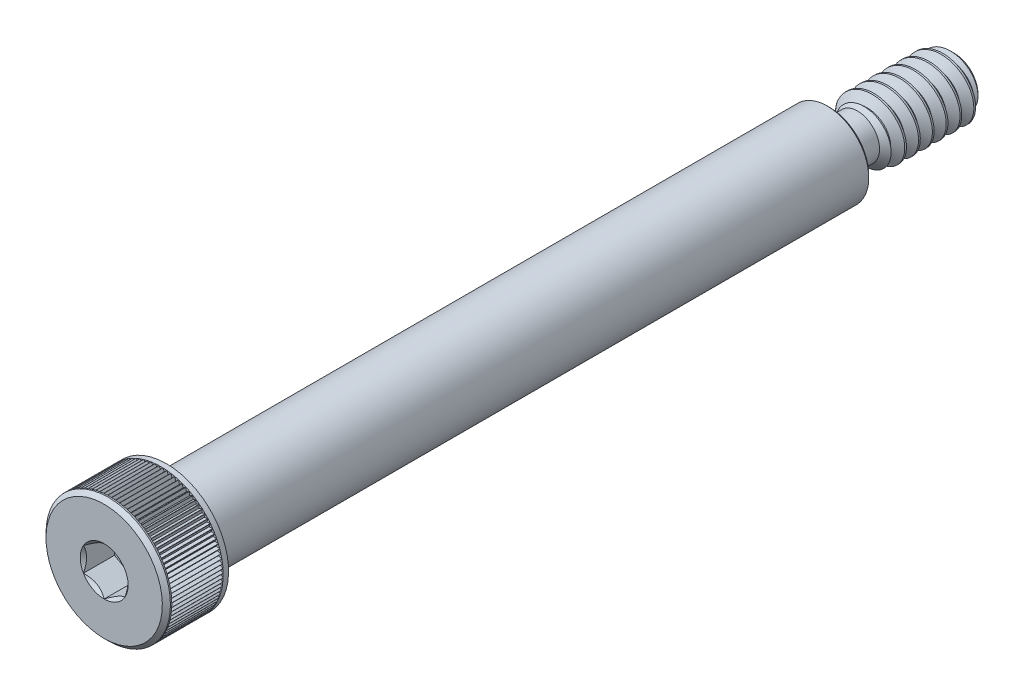
from build123d import *

# Parameters (mm, degrees)
CHAMFER1_SIZE      = 0.60325
CHAMFER2_SIZE      = 0.3095625
CHAMFER3_SIZE      = 0.2032
CUT_EXTRUDE5_DEPTH = 1.968103125
CIRPATTERN1_COUNT  = 99
CUT_EXTRUDE2_DEPTH = 2.38125
CUT_SWEEP1_PITCH   = 1.058333333


with BuildPart() as part:
    # Sketch1 → Revolve1 (revolve)
    with BuildSketch(Plane(origin=(0, 0, 0), x_dir=(0, 0, -1), z_dir=(1, 0, 0))):
        Polygon((0, 4.7625), (4.7625, 4.7625), (4.7625, 3.175), (55.5625, 3.175), (55.5625, 2.413), (65.0875, 2.413), (65.0875, 0), (0, 0), align=None)
    revolve(axis=Axis((0, 0, -65.0875), (0, 0, 1)))

    # Sketch5 → Cut-Revolve1 (revolve, cut)
    with BuildSketch(Plane(origin=(0, 0, 0), x_dir=(0, 0, -1), z_dir=(1, 0, 0))):
        with BuildLine():
            Line((55.5625, 3.175), (59.1566, 3.175))
            Line((59.1566, 3.175), (57.6707, 1.6891))
            Line((57.6707, 1.6891), (56.2864, 1.6891))
            ThreePointArc((56.2864, 1.6891), (55.774525401, 1.901125401), (55.5625, 2.413))
            Line((55.5625, 2.413), (55.5625, 3.175))
        make_face()
    revolve(axis=Axis((0, 0, -65.0875), (0, 0, 1)), mode=Mode.SUBTRACT)

    # Chamfer1
    chamfer1_edges = [part.edges().sort_by_distance(p)[0] for p in [
        (0, -2.413, -65.0875),
    ]]
    chamfer(chamfer1_edges, length=CHAMFER1_SIZE)

    # Chamfer2
    chamfer2_edges = [part.edges().sort_by_distance(p)[0] for p in [
        (0, -4.7625, 0),
    ]]
    chamfer(chamfer2_edges, length=CHAMFER2_SIZE)

    # Chamfer3
    chamfer3_edges = [part.edges().sort_by_distance(p)[0] for p in [
        (0, -3.175, -55.5625),
    ]]
    chamfer(chamfer3_edges, length=CHAMFER3_SIZE)

    # Sketch11 → Cut-Extrude5 (cut, symmetric)
    with BuildSketch(Plane.XY.offset(-2.38125)):
        Polygon((0, 4.51485), (0.142980794, 4.7625), (-0.142980794, 4.7625), align=None)
    cut_extrude5 = extrude(amount=CUT_EXTRUDE5_DEPTH, both=True, mode=Mode.SUBTRACT)

    # CirPattern1: Cut-Extrude5 ×99 about axis
    cirpattern1_axis = Axis((0, 0, 0), (0, 0, 1))
    for i in range(1, CIRPATTERN1_COUNT):
        add(cut_extrude5.rotate(cirpattern1_axis, i * 360 / CIRPATTERN1_COUNT), mode=Mode.SUBTRACT)

    # Sketch8 → Cut-Extrude2 (cut)
    with BuildSketch(Plane.XY):
        Polygon((1.5875, 0.916543552), (0, 1.833087105), (-1.5875, 0.916543552), (-1.5875, -0.916543552), (0, -1.833087105), (1.5875, -0.916543552), align=None)
    extrude(amount=-CUT_EXTRUDE2_DEPTH, mode=Mode.SUBTRACT)

    # Cut-Extrude4 cone 1 section (through the dimple's axis) → Cut-Extrude4 (revolve, cut)
    with BuildSketch(Plane(origin=(0, 0, 0), x_dir=(0, -1, 0), z_dir=(1, 0, 0))):
        Polygon((0, 0), (1.833087105, 0), (0, 1.833087105), align=None)
    revolve(axis=Axis((0, 0, 0), (0, 0, -1)), mode=Mode.SUBTRACT)

    # Cut-Sweep1: the profile of Sketch4 screwed along a right-hand helix of 10 turns, 8 arcs to a turn; built about Z, then put on its axis
    cut_sweep1_z = Axis((0, 0, 0), (0, 0, 1))
    cut_sweep1_corners = [(2.470283972, 0, 0.033072917), (2.470283972, 0, -0.959114583), (1.725592336, 0, -0.529166667), (1.725592336, 0, -0.396875)]
    with BuildLine(mode=Mode.PRIVATE) as cut_sweep1_profile:
        Line(cut_sweep1_corners[0], cut_sweep1_corners[1])
        Line(cut_sweep1_corners[1], cut_sweep1_corners[2])
        Line(cut_sweep1_corners[2], cut_sweep1_corners[3])
        Line(cut_sweep1_corners[3], cut_sweep1_corners[0])
    cut_sweep1_cap = Face(cut_sweep1_profile.wire())
    cut_sweep1_turn_angles = [0, 22.5, 45, 67.5, 90, 112.5, 135, 157.5, 180, 202.5, 225, 247.5, 270, 292.5, 315, 337.5, 360]
    cut_sweep1_turn_weights = [1, 0.9238795325112867, 1, 0.9238795325112867, 1, 0.9238795325112867, 1, 0.9238795325112867, 1, 0.9238795325112867, 1, 0.9238795325112867, 1, 0.9238795325112867, 1, 0.9238795325112867, 1]
    cut_sweep1_turn_rails = [Edge.make_bspline([Vector(p[0], p[1], 0).rotate(cut_sweep1_z, cut_sweep1_turn_angles[k]) / cut_sweep1_turn_weights[k] + Vector(0, 0, p[2] + CUT_SWEEP1_PITCH * cut_sweep1_turn_angles[k] / 360) for k in range(17)], [0, 0, 0, 1, 1, 2, 2, 3, 3, 4, 4, 5, 5, 6, 6, 7, 7, 8, 8, 8], 2, cut_sweep1_turn_weights) for p in cut_sweep1_corners]
    cut_sweep1_turn_sides = [Face.make_surface_from_curves(cut_sweep1_turn_rails[p[0]], cut_sweep1_turn_rails[p[1]]) for p in [(0, 1), (1, 2), (2, 3), (3, 0)]]
    cut_sweep1 = Plane(origin=(0, 0, -65.0875), x_dir=(0, 1, 0), z_dir=(0, 0, 1)) * Solid(Shell([*[p.moved(Location((0, 0, CUT_SWEEP1_PITCH * i))) for i in range(10) for p in cut_sweep1_turn_sides], cut_sweep1_cap, cut_sweep1_cap.rotate(cut_sweep1_z, 3600).moved(Location((0, 0, CUT_SWEEP1_PITCH * 3600 / 360)))]))
    add(cut_sweep1, mode=Mode.SUBTRACT)

    # Sketch12 → Revolve2 (revolve)
    with BuildSketch(Plane(origin=(0, 0, 0), x_dir=(0, 0, -1), z_dir=(1, 0, 0))):
        with BuildLine():
            Line((55.5625, 2.9718), (55.3593, 3.175))
            Line((55.3593, 3.175), (4.7625, 3.175))
            Line((4.7625, 3.175), (4.7625, 0))
            Line((4.7625, 0), (55.5625, 0))
            Line((55.5625, 0), (57.6707, 0))
            Line((57.6707, 0), (57.6707, 1.6891))
            Line((57.6707, 1.6891), (56.2864, 1.6891))
            ThreePointArc((56.2864, 1.6891), (55.774525401, 1.901125401), (55.5625, 2.413))
            Line((55.5625, 2.413), (55.5625, 2.9718))
        make_face()
    revolve(axis=Axis((0, 0, -4.7625), (0, 0, -1)))


solid = part.part
